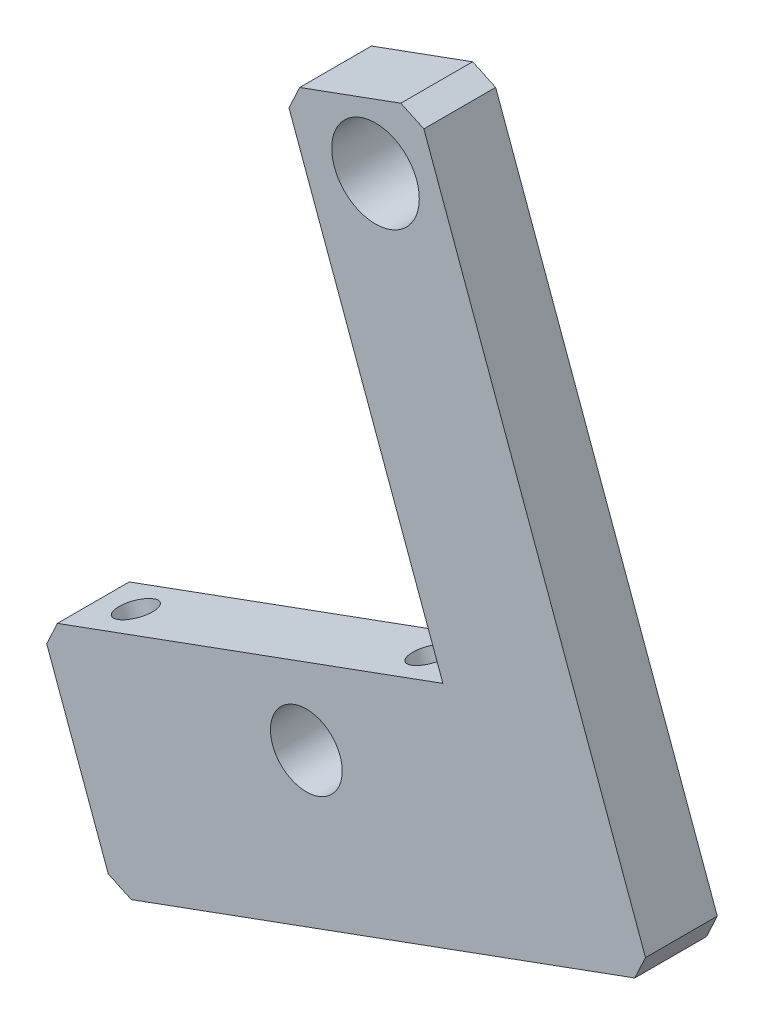
from build123d import *

# Parameters (mm, degrees)
SKETCH_1_R          = 6.1
EXTRUDE_1_DEPTH     = 10
SKETCH_2_R          = 2.5
CUT_EXTRUDE_2_DEPTH = 118.578491191
CHAMFER_1_SIZE      = 2.5
SKETCH_3_R          = 5
CUT_EXTRUDE_3_DEPTH = 135.124244668


with BuildPart() as part:
    # 草圖1 → 填料-伸長1 (new body)
    with BuildSketch(Plane.XY):
        Polygon((-29.956118011, 9.755168573), (-48.742646001, 2.894675435), (-26.446043305, -58.161540532), (-82.490240349, -78.627846462), (-72.199500643, -106.807638447), (2.631224391, -79.480839379), align=None)
        with Locations((-35.835723415, -1.346100652)):
            Circle(SKETCH_1_R, mode=Mode.SUBTRACT)
    extrude(amount=EXTRUDE_1_DEPTH)

    # 草圖2 → 除料-伸長2 (cut, through all)
    with BuildSketch(Plane(origin=(15.628555148, -42.796674065, 0), x_dir=(0.9393263994919209, 0.3430246568652819, 0), z_dir=(-0.3430246568652819, 0.939326399491921, 0))):
        with Locations((-95.671540667, -4.982155923)):
            Circle(SKETCH_2_R)
        with Locations((-52.126292594, -4.982155923)):
            Circle(SKETCH_2_R)
    extrude(amount=-CUT_EXTRUDE_2_DEPTH, mode=Mode.SUBTRACT)

    # 導角1
    chamfer_1_edges = [part.edges().sort_by_distance(p)[0] for p in [
        (-29.956118011, 9.755168573, 5),
        (-48.742646001, 2.894675435, 5),
        (2.631224391, -79.480839379, 5),
        (-72.199500643, -106.807638447, 5),
        (-82.490240349, -78.627846462, 5),
    ]]
    chamfer(chamfer_1_edges, length=CHAMFER_1_SIZE)

    # 草圖3 → 除料-伸長3 (cut, through all)
    with BuildSketch(Plane(origin=(0, 0, 0), x_dir=(-1, 0, 0), z_dir=(0, 0, -1))):
        with Locations((45.470290058, -75.754770876)):
            Circle(SKETCH_3_R)
    extrude(amount=-CUT_EXTRUDE_3_DEPTH, mode=Mode.SUBTRACT)


solid = part.part
